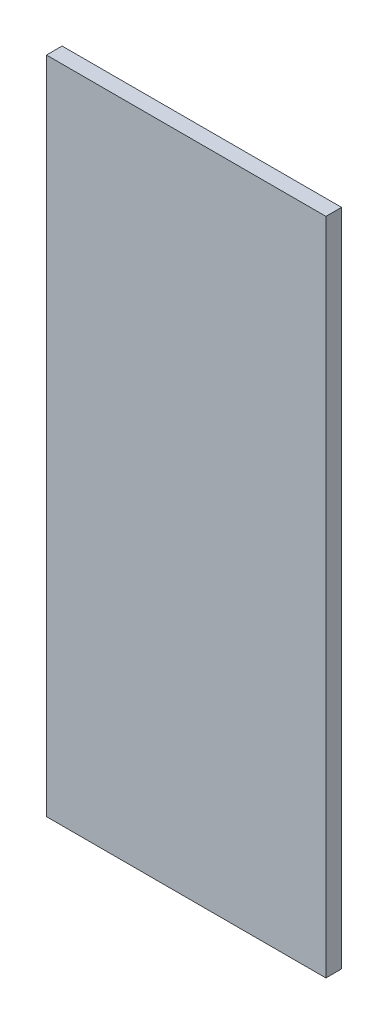
from build123d import *

# Parameters (mm, degrees)
SKETCH1_W           = 161
SKETCH1_H           = 380
BOSS_EXTRUDE1_DEPTH = 9


with BuildPart() as part:
    # Sketch1 → Boss-Extrude1 (new body)
    with BuildSketch(Plane.XY):
        Rectangle(SKETCH1_W, SKETCH1_H)
    extrude(amount=BOSS_EXTRUDE1_DEPTH)


solid = part.part
